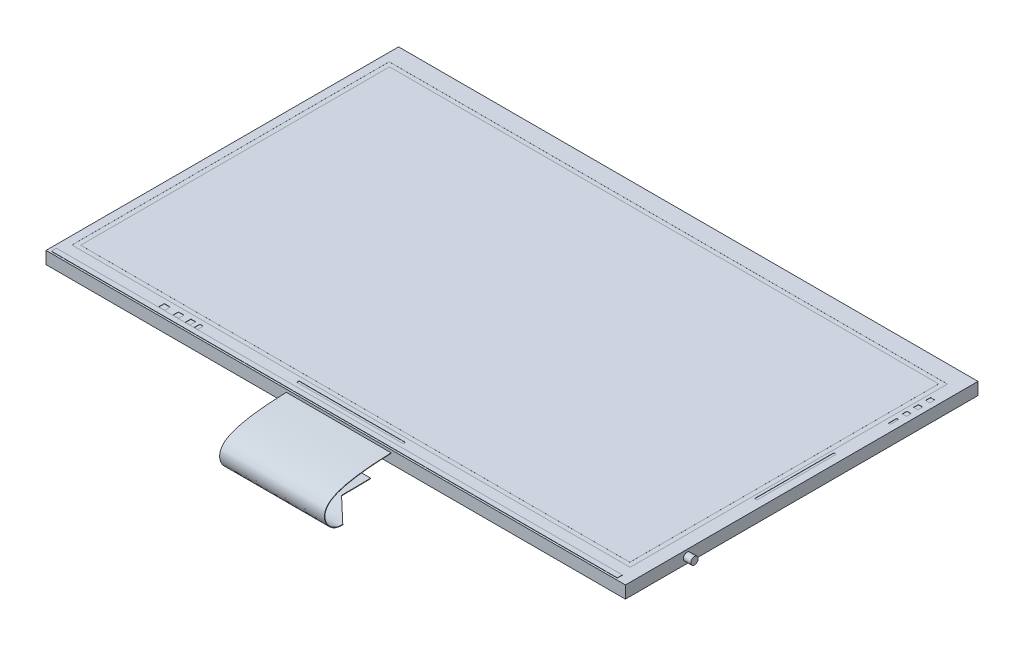
from build123d import *

# Parameters (mm, degrees)
SKETCH_1_W             = 235
SKETCH_1_H             = 143
EXTRUDE_1_DEPTH        = 5
SKETCH_2_W             = 226.4
SKETCH_2_H             = 128.7
SKETCH_2_W_2           = 222.72
SKETCH_2_H_2           = 125.28
CUT_EXTRUDE_946_DEPTH  = 0.02
SKETCH_3_W             = 222.72
SKETCH_3_H             = 125.28
CUT_EXTRUDE_2_DEPTH    = 0.01
SKETCH_9_W             = 43.231071258
SKETCH_9_H             = 0.914041318
SKETCH_9_W_2           = 0.989446634
SKETCH_9_H_2           = 32.252128775
IC_DEPTH               = 0.1
SKETCH_10_W            = 229.528734104
SKETCH_10_H            = 2.042373104
EXTRUDE_1609_DEPTH     = 0.1
SKETCH_12_W            = 1.752275411
SKETCH_12_H            = 1.95842546
SKETCH_12_H_2          = 2.061500484
SKETCH_12_W_2          = 0.821661147
SKETCH_12_H_3          = 3.334977598
SKETCH_12_W_3          = 1.391919846
SKETCH_12_H_4          = 2.248485905
SKETCH_12_W_4          = 1.927273633
SKETCH_12_W_5          = 2.248485905
SKETCH_12_W_6          = 2.46262742
CUT_EXTRUDE_1968_DEPTH = 0.1
SKETCH_6_R             = 1.5
EXTRUDE_2975_DEPTH     = 3
EXTRUDE_START          = -20
EXTRUDE_3073_DEPTH     = 42.5
CUT_EXTRUDE_10_DEPTH   = 20


# Read off the part's stored shape, not the designer's step: 显示器出线
with BuildPart() as part:
    # 草图1 → 凸台-拉伸1 (new body)
    with BuildSketch(Plane(origin=(0, 0, 0), x_dir=(1, 0, 0), z_dir=(0, 1, 0))):
        Rectangle(SKETCH_1_W, SKETCH_1_H)
    extrude(amount=EXTRUDE_1_DEPTH)

    # 草图2 → Cut-Extrude 946 (cut)
    with BuildSketch(Plane(origin=(0, 5, 0), x_dir=(1, 0, 0), z_dir=(0, 1, 0))):
        with Locations((-0.95, 0)):
            Rectangle(SKETCH_2_W, SKETCH_2_H)
        with Locations((-0.95, 0)):
            Rectangle(SKETCH_2_W_2, SKETCH_2_H_2, mode=Mode.SUBTRACT)
    extrude(amount=-CUT_EXTRUDE_946_DEPTH, mode=Mode.SUBTRACT)

    # 草图3 → 切除-拉伸2 (cut)
    with BuildSketch(Plane(origin=(0, 5, 0), x_dir=(1, 0, 0), z_dir=(0, 1, 0))):
        with Locations((-0.95, 0)):
            Rectangle(SKETCH_3_W, SKETCH_3_H)
    extrude(amount=-CUT_EXTRUDE_2_DEPTH, mode=Mode.SUBTRACT)

    # 草图9 → 驱动IC (cut)
    with BuildSketch(Plane(origin=(0, 5, 0), x_dir=(1, 0, 0), z_dir=(0, 1, 0))):
        with Locations((1.279638732, -66.49846616)):
            Rectangle(SKETCH_9_W, SKETCH_9_H)
        with Locations((113.850935725, 1.100856888)):
            Rectangle(SKETCH_9_W_2, SKETCH_9_H_2)
    extrude(amount=-IC_DEPTH, mode=Mode.SUBTRACT)

    # 草图10 → Extrude 1609 (add)
    with BuildSketch(Plane(origin=(0, 5, 0), x_dir=(1, 0, 0), z_dir=(0, 1, 0))):
        with Locations((-1.302960394, -69.73680436)):
            Rectangle(SKETCH_10_W, SKETCH_10_H)
    extrude(amount=EXTRUDE_1609_DEPTH)

    # 草图12 → Cut-Extrude 1968 (cut)
    with BuildSketch(Plane(origin=(0, 5, 0), x_dir=(1, 0, 0), z_dir=(0, 1, 0))):
        with Locations((114.427090568, 45.651616033)):
            Rectangle(SKETCH_12_W, SKETCH_12_H)
        with Locations((114.427090568, 50.289992121)):
            Rectangle(SKETCH_12_W, SKETCH_12_H)
        with Locations((114.427090568, 55.18605577)):
            Rectangle(SKETCH_12_W, SKETCH_12_H_2)
        with Locations((114.436218982, 40.342954237)):
            Rectangle(SKETCH_12_W_2, SKETCH_12_H_3)
        with Locations((-59.67691262, -67.327753911)):
            Rectangle(SKETCH_12_W_3, SKETCH_12_H_4)
        with Locations((-63.049641478, -67.327753911)):
            Rectangle(SKETCH_12_W_4, SKETCH_12_H_4)
        with Locations((-67.921360937, -67.327753911)):
            Rectangle(SKETCH_12_W_5, SKETCH_12_H_4)
        with Locations((-73.596111078, -67.327753911)):
            Rectangle(SKETCH_12_W_6, SKETCH_12_H_4)
    extrude(amount=-CUT_EXTRUDE_1968_DEPTH, mode=Mode.SUBTRACT)

    # 草图6 → Extrude 2975 (add)
    with BuildSketch(Plane(origin=(117.5, 0, 0), x_dir=(0, 0, -1), z_dir=(1, 0, 0))):
        with Locations(Location((-46.5, 2.5, 0), (0, 0, 180))):
            Circle(SKETCH_6_R)
    extrude(amount=EXTRUDE_2975_DEPTH)


with BuildPart() as body_2:
    # Extrude 3073 outline → Extrude 3073 (new body)
    with BuildSketch(Plane(origin=(0, 0, 0), x_dir=(0, 0, -1), z_dir=(1, 0, 0)).offset(EXTRUDE_START)):
        with BuildLine():
            Line((-71.5, 3.715080853), (-71.510941867, 3.914781317))
            add(Edge.make_bspline(
                [(-71.510941867, 3.914781317), (-71.754872478, 3.901416018), (-72.194627935, 3.886763321), (-73.375759203, 3.844189538), (-74.118468696, 3.816160416), (-76.687488083, 3.694423661), (-78.854740178, 3.563082228), (-83.488334604, 3.106680779), (-85.954589269, 2.781725794), (-90.579689225, 1.843151605), (-92.738088621, 1.230687146), (-95.298568099, 0.013827058), (-96.03901686, -0.44346832), (-97.221733342, -1.472185096), (-97.669095243, -2.039061022), (-98.614896037, -3.827959887), (-98.713721913, -5.134815257), (-98.106970737, -7.591942772), (-97.404747884, -8.745092281), (-95.457384583, -10.564446673), (-94.210454059, -11.23132569), (-92.465397642, -11.541011542), (-92.106307033, -11.575415238), (-91.381240644, -11.594111693), (-91.015133288, -11.579658489), (-89.921936504, -11.48615957), (-89.199790652, -11.357035963), (-88.19172911, -11.144940279), (-87.868265248, -11.071147612), (-87.257934145, -10.930863762), (-86.971110762, -10.864833729), (-86.159796466, -10.678644701), (-85.684921812, -10.570266672), (-84.42053346, -10.286760291), (-83.791272064, -10.153303985), (-82.759616666, -9.967236766), (-82.357844012, -9.914586008), (-81.571899715, -9.857819276), (-81.186286297, -9.853698372), (-80.22152636, -9.864877736), (-79.643229224, -9.880196341), (-77.322866146, -9.909696774), (-74.996130434, -9.907296329), (-71.07852286, -9.761341876)],
                knots=[0, 0, 0, 0, 0.03125, 0.03125, 0.0625, 0.0625, 0.125, 0.125, 0.1875, 0.1875, 0.25, 0.25, 0.28125, 0.28125, 0.3125, 0.3125, 0.375, 0.375, 0.4375, 0.4375, 0.5, 0.5, 0.515625, 0.515625, 0.53125, 0.53125, 0.5625, 0.5625, 0.578125, 0.578125, 0.59375, 0.59375, 0.625, 0.625, 0.6875, 0.6875, 0.75, 0.75, 0.8125, 0.8125, 0.875, 0.875, 1, 1, 1, 1], degree=3))
            Line((-71.07852286, -9.761341876), (-71.085968898, -9.561480532))
            add(Edge.make_bspline(
                [(-71.5, 3.715080853), (-73.69113346, 3.595025589), (-104.84149021, 3.243041633), (-96.396950011, -12.830379964), (-78.578293713, -8.725552261), (-84.244341591, -10.051709086), (-71.085968898, -9.561480532)],
                knots=[0, 0, 0, 0, 0.275007382, 0.507346711, 0.579845973, 1, 1, 1, 1], degree=3))
        make_face()
    extrude(amount=EXTRUDE_3073_DEPTH)

    # 草图8 → 切除-拉伸10 (cut)
    with BuildSketch(Plane.XZ):
        Polygon((-11.75, -0.135871582), (-41.070949031, -0.135871582), (-41.070949031, 95.755276899), (-22.423816173, 95.755276899), (-22.423816173, 92.938340681), (-11.75, 82.88168411), align=None)
        Polygon((43.070949031, 95.755276899), (24.423816173, 95.755276899), (24.423816173, 92.938340681), (13.75, 82.88168411), (13.75, -0.135871582), (43.070949031, -0.135871582), align=None)
    extrude(amount=CUT_EXTRUDE_10_DEPTH, mode=Mode.SUBTRACT)


solid = Compound([part.part, body_2.part])
